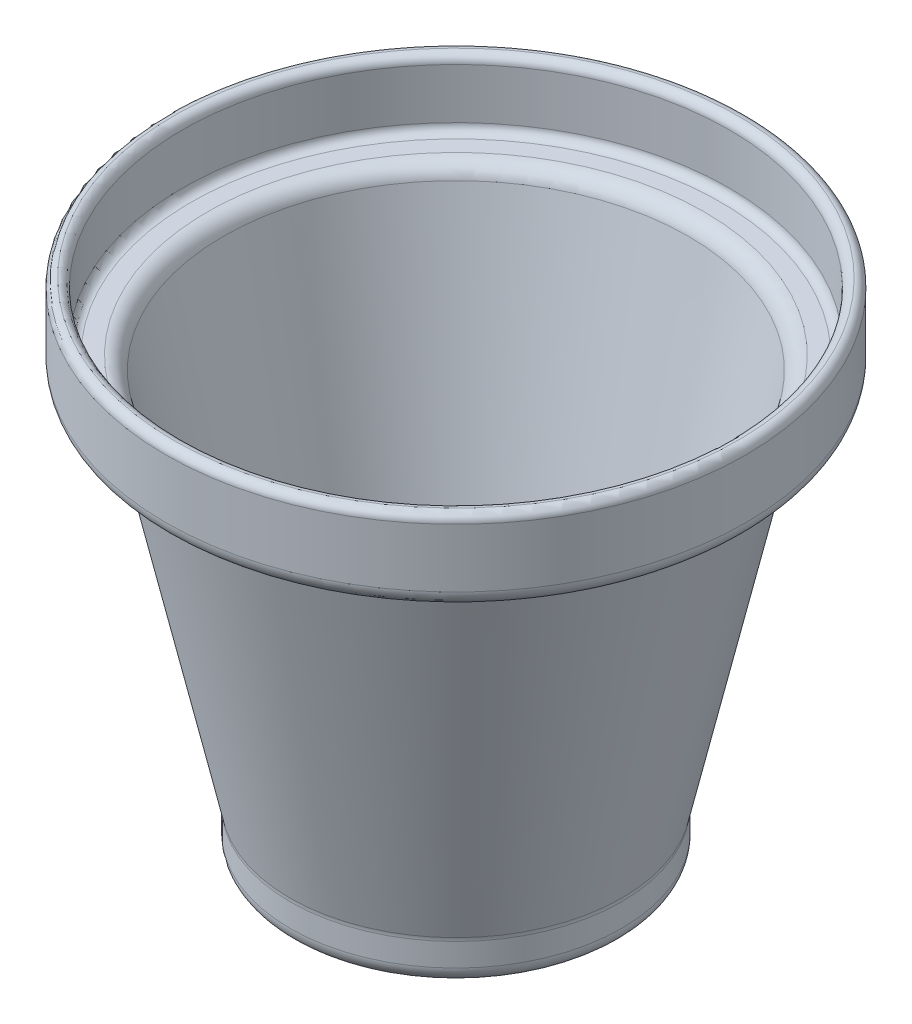
from build123d import *

# Parameters (mm, degrees)
FILLET1_R = 2.54
FILLET2_R = 1.27


with BuildPart() as part:
    # Sketch1 → Revolve1 (revolve)
    with BuildSketch(Plane.XY, mode=Mode.PRIVATE) as revolve1_sk:
        Polygon((0, 0), (25.4, 0), (25.4, 6.35), (38.1, 63.402818228), (44.45, 63.402818228), (44.45, 76.2), (41.91, 76.2), (41.91, 65.942818228), (36.061089782, 65.942818228), (22.86, 6.35), (22.86, 2.54), (0, 2.54), align=None)
    revolve(revolve1_sk.sketch.rotate(Axis((0, 76.2, 0), (0, 1, 0)), 90), axis=Axis((0, 76.2, 0), (0, 1, 0)))

    # Fillet1
    fillet1_edges = [part.edges().sort_by_distance(p)[0] for p in [
        (0, 63.402818228, 44.45),
        (0, 65.942818228, 36.061089782),
        (0, 0, 25.4),
        (0, 6.35, 25.4),
        (0, 63.402818228, 38.1),
    ]]
    fillet(fillet1_edges, radius=FILLET1_R)

    # Fillet2
    fillet2_edges = [part.edges().sort_by_distance(p)[0] for p in [
        (0, 76.2, 44.45),
        (0, 76.2, 41.91),
        (0, 65.942818228, 41.91),
        (0, 6.35, 22.86),
        (0, 2.54, 22.86),
    ]]
    fillet(fillet2_edges, radius=FILLET2_R - 0.0001)  # a hair under: the kernel refuses the full size


solid = part.part
